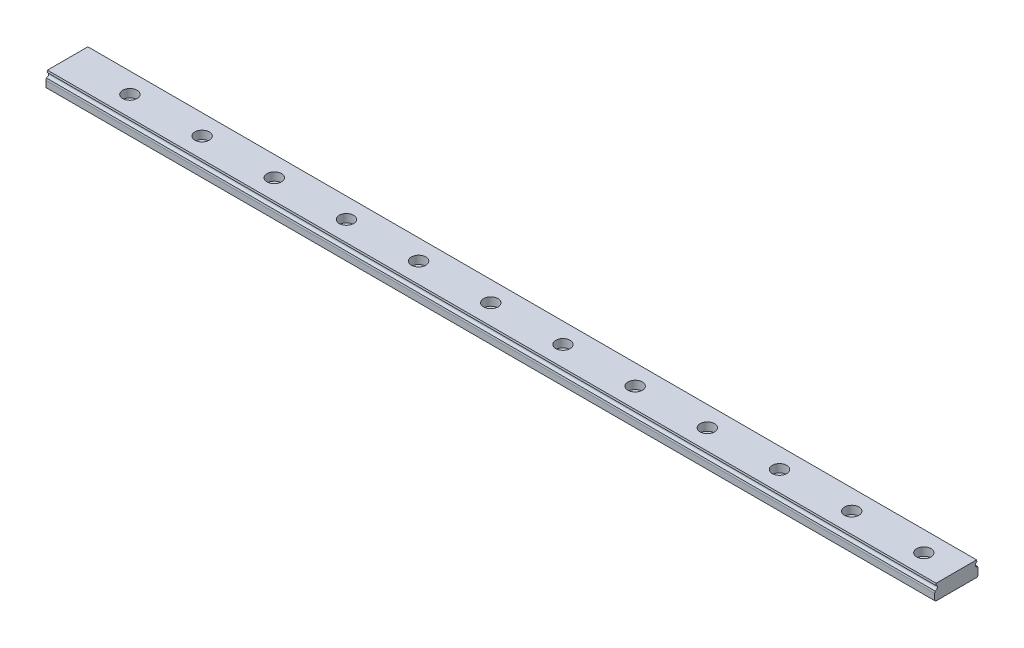
from build123d import *

# Parameters (mm, degrees)
RESSALTO_EXTRUS_O1_DEPTH      = 353
RESSALTO_EXTRUS_O1_DEPTH_BACK = 139.5
LPATTERN1_COUNT               = 8
LPATTERN1_PITCH               = 40
LPATTERN1_COUNT_DIR2          = 5
LPATTERN1_PITCH_DIR2          = 40


with BuildPart() as part:
    # Esboço1 → Ressalto-extrusão1 (new, two sides: drawn at the far end of the back side and taken through both)
    with BuildSketch(Plane(origin=(-15, 0, 0), x_dir=(0, 0, -1), z_dir=(1, 0, 0)).offset(-RESSALTO_EXTRUS_O1_DEPTH_BACK)):
        with BuildLine():
            Line((-12, 4), (-12, 0.5))
            Line((-12, 0.5), (-11.5, 0))
            Line((-11.5, 0), (11.5, 0))
            Line((11.5, 0), (12, 0.5))
            Line((12, 0.5), (12, 4))
            Line((12, 4), (11.814562479, 5.051668439))
            ThreePointArc((11.814562479, 5.051668439), (10.518990309, 6.082939778), (11.383714346, 7.495129625))
            Line((11.383714346, 7.495129625), (11.206528587, 8.5))
            Line((11.206528587, 8.5), (-11.206528587, 8.5))
            Line((-11.206528587, 8.5), (-11.383714346, 7.495129625))
            ThreePointArc((-11.383714346, 7.495129625), (-10.518990309, 6.082939778), (-11.814562479, 5.051668439))
            Line((-11.814562479, 5.051668439), (-12, 4))
        make_face()
    extrude(amount=RESSALTO_EXTRUS_O1_DEPTH + RESSALTO_EXTRUS_O1_DEPTH_BACK)

    # Esboço3 → Corte-Revolução2 (revolve, cut)
    with BuildSketch(Plane.XY):
        Polygon((40, 8.5), (44, 8.5), (44, 4), (42.25, 4), (42.25, 0), (40, 0), align=None)
    corte_revolu_o2 = revolve(axis=Axis((40, 0, 0), (0, 1, 0)), mode=Mode.SUBTRACT)

    # LPattern1: Corte-Revolu_o2 8 × 5
    with Locations(*[Vector(1, 0, 0) * (i * LPATTERN1_PITCH) + Vector(-1, 0, 0) * (j * LPATTERN1_PITCH_DIR2) for i in range(LPATTERN1_COUNT) for j in range(LPATTERN1_COUNT_DIR2) if (i, j) != (0, 0)]):
        add(corte_revolu_o2, mode=Mode.SUBTRACT)


solid = part.part
